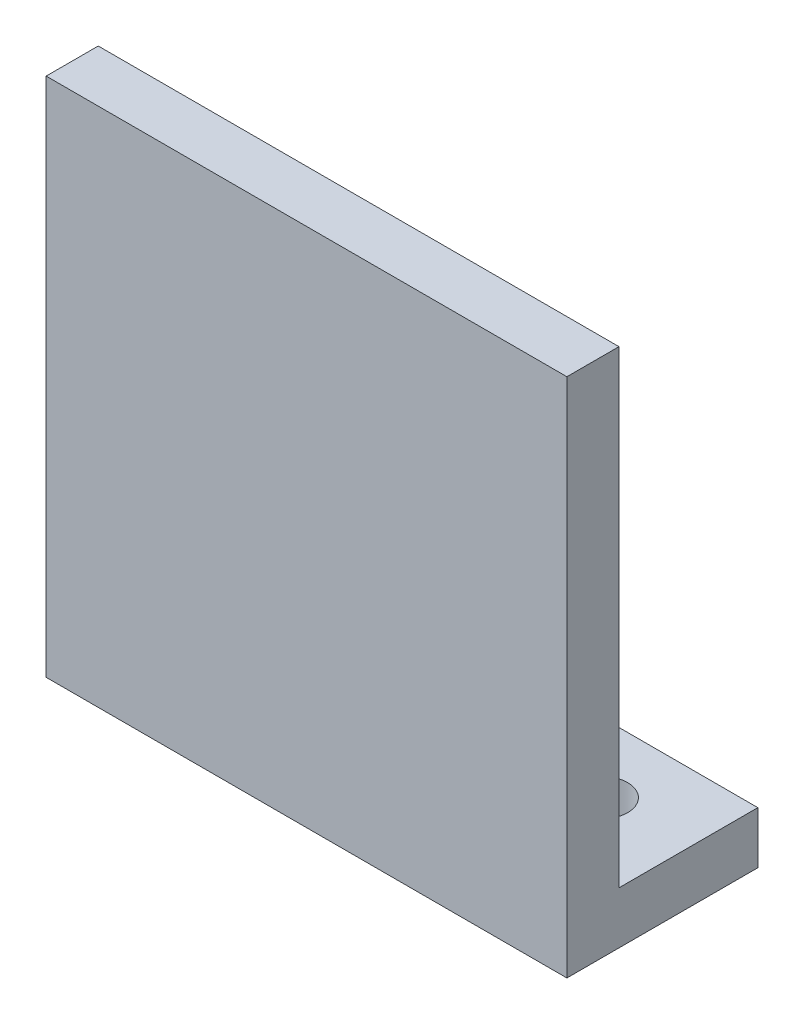
from build123d import *

# Parameters (mm, degrees)
SKETCH_1_W            = 30
SKETCH_1_H            = 30
EXTRUDE_1_DEPTH       = 3
SKETCH_2_W            = 30
SKETCH_2_H            = 3
EXTRUDE_2_DEPTH       = 8
EXTRUDE_3_OUTLINE_W   = 9.855829453
EXTRUDE_3_OUTLINE_H   = 1.616898148
EXTRUDE_3_OUTLINE_W_2 = 2.508871201
EXTRUDE_3_OUTLINE_H_2 = 1.021198831
EXTRUDE_3_DEPTH       = 2
SKETCH_4_R            = 1.5
CUT_EXTRUDE_1_DEPTH   = 32.906112399


# Read off the part's stored shape, not the designer's step: 凸台-拉伸3
with BuildPart() as part:
    # 草图1 → 凸台-拉伸1 (new body)
    with BuildSketch(Plane.XY):
        Rectangle(SKETCH_1_W, SKETCH_1_H)
    extrude(amount=EXTRUDE_1_DEPTH)

    # 草图2 → 凸台-拉伸2 (add)
    with BuildSketch(Plane(origin=(0, 0, 0), x_dir=(-1, 0, 0), z_dir=(0, 0, -1))):
        with Locations((0, -13.5)):
            Rectangle(SKETCH_2_W, SKETCH_2_H)
    extrude(amount=EXTRUDE_2_DEPTH)

    # 凸台-拉伸3 outline → 凸台-拉伸3 (add)
    # profile 1 of 7: a face of its own
    with BuildSketch(Plane(origin=(0, 0, 0), x_dir=(-1, 0, 0), z_dir=(0, 0, -1))):
        with BuildLine():
            add(Edge.make_bspline(
                [(-7.883877872, -0.091981962), (-8.014273136, -0.095319591), (-8.286344386, -0.102283592), (-8.711792724, -0.152580431), (-9.170964428, -0.235771427), (-9.487413499, -0.309118528), (-9.652064735, -0.34728167)],
                knots=[0, 0, 0, 0, 0.218453159, 0.455805081, 0.716850593, 1, 1, 1, 1], degree=3))
            Line((-7.883877872, -0.091981962), (9.687676078, -0.091981962))
            Line((9.687676078, -0.091981962), (8.200003707, 1.354716381))
            Line((8.200003707, 1.354716381), (7.178804877, 0.418617453))
            Line((7.178804877, 0.418617453), (0.484279211, 0.418617453))
            add(Edge.make_bspline(
                [(0.856197303, 1.014316771), (0.852191328, 0.958898776), (0.844084462, 0.84674976), (0.767461294, 0.687273844), (0.648127721, 0.53897471), (0.541108483, 0.460362204), (0.484279211, 0.418617453)],
                knots=[0, 0, 0, 0, 0.226102906, 0.457562904, 0.711955478, 1, 1, 1, 1], degree=3))
            add(Edge.make_bspline(
                [(-0.817434113, 2.375915211), (-0.721630556, 2.327972841), (-0.539663046, 2.236911987), (-0.282899364, 2.100929668), (-0.056069037, 1.973018309), (0.139174602, 1.850403681), (0.303845782, 1.7362347), (0.440893543, 1.633866613), (0.546212555, 1.537112963), (0.639510318, 1.422807589), (0.715903062, 1.296068897), (0.793486514, 1.177404686), (0.839652321, 1.086342529), (0.851564512, 1.034484838), (0.856197303, 1.014316771)],
                knots=[0, 0, 0, 0, 0.144926459, 0.275270644, 0.393035019, 0.497141681, 0.587034222, 0.664074804, 0.72842807, 0.779930298, 0.863111262, 0.928198056, 0.972075377, 1, 1, 1, 1], degree=3))
            Line((-0.817434113, 2.375915211), (-1.003393159, 2.120615504))
            add(Edge.make_bspline(
                [(-0.354112421, 0.418617453), (-0.362500426, 0.561245045), (-0.379562278, 0.851360607), (-0.506832291, 1.283829906), (-0.714713, 1.713501451), (-0.904647522, 1.981358491), (-1.003393159, 2.120615504)],
                knots=[0, 0, 0, 0, 0.230672027, 0.469204759, 0.724043244, 1, 1, 1, 1], degree=3))
            Line((-0.354112421, 0.418617453), (-10.487304519, 0.418617453))
            Line((-10.487304519, 0.418617453), (-9.652064735, -0.34728167))
        make_face()
    # profile 2 of 7: a face of its own
    with BuildSketch(Plane(origin=(0, 0, 0), x_dir=(-1, 0, 0), z_dir=(0, 0, -1))):
        with BuildLine():
            add(Edge.make_bspline(
                [(5.50517346, -5.368175919), (5.504512968, -5.523672258), (5.503254395, -5.819971501), (5.511695643, -6.241235963), (5.51653788, -6.617408103), (5.526053772, -6.948377629), (5.537960262, -7.234236324), (5.553693194, -7.474869964), (5.570786348, -7.670663904), (5.588723897, -7.785706695), (5.596577059, -7.836073093)],
                knots=[0, 0, 0, 0, 0.188745628, 0.359655974, 0.511439094, 0.64540111, 0.761566226, 0.858699185, 0.938137688, 1, 1, 1, 1], degree=3))
            Line((5.50517346, -5.368175919), (6.154454198, -4.942676407))
            Line((6.154454198, -4.942676407), (4.947296322, -3.836377674))
            Line((4.947296322, -3.836377674), (4.108904689, -4.602276797))
            Line((4.108904689, -4.602276797), (-5.560965717, -4.602276797))
            Line((-5.560965717, -4.602276797), (-6.862679041, -4.006577479))
            add(Edge.make_bspline(
                [(-6.862679041, -8.431772411), (-6.834696822, -8.081053429), (-6.777121088, -7.359420064), (-6.763264157, -6.254873958), (-6.778225727, -5.129478561), (-6.834720275, -4.378320486), (-6.862679041, -4.006577479)],
                knots=[0, 0, 0, 0, 0.238171099, 0.490056772, 0.747632576, 1, 1, 1, 1], degree=3))
            Line((-6.862679041, -8.431772411), (-5.560965717, -8.006272898))
            Line((-5.560965717, -8.006272898), (-5.560965717, -7.240373775))
            Line((-5.560965717, -7.240373775), (4.294863736, -7.240373775))
            Line((4.294863736, -7.240373775), (4.294863736, -8.176472703))
            Line((4.294863736, -8.176472703), (5.596577059, -7.836073093))
        make_face()
        with Locations((-0.633050991, -5.921325286)):
            Rectangle(EXTRUDE_3_OUTLINE_W, EXTRUDE_3_OUTLINE_H, mode=Mode.SUBTRACT)
    # profile 3 of 7: a face of its own
    with BuildSketch(Plane(origin=(0, 0, 0), x_dir=(-1, 0, 0), z_dir=(0, 0, -1))):
        with BuildLine():
            add(Edge.make_bspline(
                [(-4.631170486, -1.623780208), (-4.760506504, -1.627206631), (-5.0325524, -1.634413783), (-5.457075808, -1.683759923), (-5.916075791, -1.768026461), (-6.231541559, -1.840993333), (-6.396205501, -1.879079916)],
                knots=[0, 0, 0, 0, 0.217072505, 0.456591169, 0.716356417, 1, 1, 1, 1], degree=3))
            Line((-4.631170486, -1.623780208), (6.063050599, -1.623780208))
            Line((6.063050599, -1.623780208), (4.852740874, -0.432381572))
            Line((4.852740874, -0.432381572), (4.108904689, -1.113180793))
            Line((4.108904689, -1.113180793), (-7.234597134, -1.113180793))
            Line((-7.234597134, -1.113180793), (-6.396205501, -1.879079916))
        make_face()
    # profile 4 of 7: a face of its own
    with BuildSketch(Plane(origin=(0, 0, 0), x_dir=(-1, 0, 0), z_dir=(0, 0, -1))):
        with BuildLine():
            add(Edge.make_bspline(
                [(-4.164696946, -3.240678356), (-4.29509221, -3.244015985), (-4.56716346, -3.250979986), (-4.992611798, -3.301276824), (-5.451783502, -3.38446782), (-5.768232573, -3.457814921), (-5.93288381, -3.495978064)],
                knots=[0, 0, 0, 0, 0.218453159, 0.455805081, 0.716850593, 1, 1, 1, 1], degree=3))
            Line((-4.164696946, -3.240678356), (6.340413245, -3.240678356))
            Line((6.340413245, -3.240678356), (5.133255368, -2.049279721))
            Line((5.133255368, -2.049279721), (4.389419183, -2.730078941))
            Line((4.389419183, -2.730078941), (-6.768123594, -2.730078941))
            Line((-6.768123594, -2.730078941), (-5.93288381, -3.495978064))
        make_face()
    # profile 5 of 7: a face of its own
    with BuildSketch(Plane(origin=(0, 0, 0), x_dir=(-1, 0, 0), z_dir=(0, 0, -1))):
        with BuildLine():
            add(Edge.make_bspline(
                [(-3.234901715, 5.099112092), (-3.235551773, 4.997194692), (-3.236798427, 4.801741842), (-3.228323569, 4.522327705), (-3.223548545, 4.270102792), (-3.213805252, 4.04419127), (-3.201859345, 3.844470475), (-3.186315243, 3.671030427), (-3.168421576, 3.524663933), (-3.151285285, 3.436966155), (-3.143498116, 3.397114042)],
                knots=[0, 0, 0, 0, 0.179134848, 0.343537183, 0.491323426, 0.622559743, 0.740982427, 0.842972586, 0.928642726, 1, 1, 1, 1], degree=3))
            Line((-3.234901715, 5.099112092), (-2.677024576, 5.439511702))
            Line((-2.677024576, 5.439511702), (-3.701375254, 6.37561063))
            Line((-3.701375254, 6.37561063), (-4.44521144, 5.69481141))
            Line((-4.44521144, 5.69481141), (-6.676719995, 5.69481141))
            Line((-6.676719995, 5.69481141), (-7.792474273, 6.290510728))
            add(Edge.make_bspline(
                [(-7.326000733, 6.71601024), (-7.414526691, 6.655673023), (-7.590203272, 6.535935986), (-7.725403424, 6.371891056), (-7.792474273, 6.290510728)],
                knots=[0, 0, 0, 0, 0.5039144, 1, 1, 1, 1], degree=3))
            Line((-7.326000733, 6.71601024), (-1.283907653, 6.71601024))
            add(Edge.make_bspline(
                [(-4.631170486, 2.716314821), (-4.491524671, 2.695708874), (-4.226178282, 2.656554719), (-3.84966376, 2.611058386), (-3.516943295, 2.570933973), (-3.227749243, 2.546344103), (-2.981908453, 2.530311475), (-2.778897921, 2.52164569), (-2.619937333, 2.527557491), (-2.462958634, 2.544565128), (-2.295038594, 2.621573083), (-2.122684837, 2.785029584), (-1.9722409, 3.023854964), (-1.851753499, 3.272095615), (-1.762956897, 3.533043934), (-1.697837515, 3.80062016), (-1.622971544, 4.129761015), (-1.556936453, 4.523755329), (-1.487090168, 4.981797251), (-1.419142177, 5.50317383), (-1.349254729, 6.088343634), (-1.306446784, 6.499519152), (-1.283907653, 6.71601024)],
                knots=[0, 0, 0, 0, 0.063705758, 0.121049763, 0.171162397, 0.214951261, 0.252012945, 0.282375059, 0.306576652, 0.323810867, 0.353324311, 0.387900204, 0.429590006, 0.480066987, 0.512157216, 0.55379035, 0.604296276, 0.664479351, 0.734021834, 0.813423404, 0.901764165, 1, 1, 1, 1], degree=3))
            Line((-4.631170486, 2.716314821), (-4.631170486, 2.461015114))
            add(Edge.make_bspline(
                [(-2.957539069, 1.014316771), (-2.976744783, 1.090972797), (-3.015419023, 1.245333821), (-3.12745842, 1.462075019), (-3.276639421, 1.666016498), (-3.471187333, 1.852510209), (-3.701545914, 2.029815561), (-3.97472243, 2.18899115), (-4.287617097, 2.334932744), (-4.512800833, 2.417574045), (-4.631170486, 2.461015114)],
                knots=[0, 0, 0, 0, 0.102068697, 0.205534117, 0.313596329, 0.428115607, 0.553327272, 0.689398452, 0.836729783, 1, 1, 1, 1], degree=3))
            add(Edge.make_bspline(
                [(-0.168153375, 6.37561063), (-0.184404089, 6.202206897), (-0.216048847, 5.864540557), (-0.271769943, 5.370344689), (-0.340346782, 4.902341936), (-0.405508583, 4.456559781), (-0.490580467, 4.039415987), (-0.573266115, 3.645319785), (-0.669597488, 3.278103462), (-0.766214458, 2.930778383), (-0.891580631, 2.606382732), (-1.059862045, 2.307823296), (-1.272240626, 2.033280002), (-1.52509894, 1.779453984), (-1.82470385, 1.554179778), (-2.161888971, 1.347412227), (-2.542156254, 1.163934441), (-2.815750253, 1.065388003), (-2.957539069, 1.014316771)],
                knots=[0, 0, 0, 0, 0.080072776, 0.155924448, 0.228606305, 0.297536709, 0.362994913, 0.424293292, 0.482635301, 0.537506901, 0.58997895, 0.642103026, 0.694466025, 0.749113941, 0.806306908, 0.866367196, 0.930745422, 1, 1, 1, 1], degree=3))
            Line((-0.168153375, 6.37561063), (0.484279211, 6.886210045))
            Line((0.484279211, 6.886210045), (-0.631475067, 7.907408876))
            Line((-0.631475067, 7.907408876), (-1.375311252, 7.226609656))
            Line((-1.375311252, 7.226609656), (-7.048638087, 7.226609656))
            add(Edge.make_bspline(
                [(-6.304801902, 7.652109168), (-6.390276459, 7.611855136), (-6.546779647, 7.538150343), (-6.756168768, 7.427178752), (-6.922606638, 7.330208936), (-7.01043283, 7.25801481), (-7.048638087, 7.226609656)],
                knots=[0, 0, 0, 0, 0.329697503, 0.60367333, 0.827594001, 1, 1, 1, 1], degree=3))
            Line((-6.304801902, 7.652109168), (-7.883877872, 8.503108194))
            add(Edge.make_bspline(
                [(-10.581859967, 4.333212969), (-10.403172371, 4.515042619), (-10.056306953, 4.868007339), (-9.586756661, 5.415847011), (-9.170874205, 5.953370374), (-8.817572434, 6.488631946), (-8.514916636, 7.013068413), (-8.255595053, 7.521172141), (-8.044331014, 8.015092916), (-7.936302585, 8.343659393), (-7.883877872, 8.503108194)],
                knots=[0, 0, 0, 0, 0.152428867, 0.295892407, 0.431244828, 0.558637663, 0.679129134, 0.793218188, 0.899651625, 1, 1, 1, 1], degree=3))
            Line((-10.581859967, 4.333212969), (-10.487304519, 4.077913262))
            add(Edge.make_bspline(
                [(-7.883877872, 6.120310923), (-8.061696023, 5.925092794), (-8.422781929, 5.528673674), (-9.046911705, 5.000406817), (-9.733268141, 4.505316999), (-10.232242553, 4.222487769), (-10.487304519, 4.077913262)],
                knots=[0, 0, 0, 0, 0.23791436, 0.483120096, 0.73578524, 1, 1, 1, 1], degree=3))
            add(Edge.make_bspline(
                [(-7.883877872, 2.716314821), (-7.869248043, 2.847550469), (-7.839216317, 3.116947545), (-7.811970814, 3.532319287), (-7.797309829, 3.968527973), (-7.78997881, 4.418313864), (-7.79739957, 4.869143812), (-7.811744328, 5.30537005), (-7.839394936, 5.720716148), (-7.869268563, 5.989074004), (-7.883877872, 6.120310923)],
                knots=[0, 0, 0, 0, 0.116131467, 0.238391611, 0.365996644, 0.499999222, 0.634001801, 0.7625303, 0.883868533, 1, 1, 1, 1], degree=3))
            Line((-7.883877872, 2.716314821), (-6.768123594, 3.056714431))
            Line((-6.768123594, 3.056714431), (-6.768123594, 3.652413749))
            Line((-6.768123594, 3.652413749), (-4.259252393, 3.652413749))
            Line((-4.259252393, 3.652413749), (-4.259252393, 3.056714431))
            Line((-4.259252393, 3.056714431), (-3.143498116, 3.397114042))
        make_face()
        with Locations((-5.513687994, 4.67361258)):
            Rectangle(EXTRUDE_3_OUTLINE_W_2, EXTRUDE_3_OUTLINE_H_2, mode=Mode.SUBTRACT)
    # profile 6 of 7: a face of its own
    with BuildSketch(Plane(origin=(0, 0, 0), x_dir=(-1, 0, 0), z_dir=(0, 0, -1))):
        with BuildLine():
            add(Edge.make_bspline(
                [(4.947296322, 3.737513652), (4.797600927, 3.618730319), (4.496049828, 3.379449447), (4.010841647, 3.057549626), (3.503964927, 2.753446357), (2.968553622, 2.476174859), (2.408162519, 2.220805626), (1.820875599, 1.991069573), (1.208424423, 1.785567203), (0.788473955, 1.669053967), (0.57568281, 1.610016088)],
                knots=[0, 0, 0, 0, 0.116970004, 0.235628045, 0.356221885, 0.478803688, 0.60461802, 0.733165998, 0.864793786, 1, 1, 1, 1], degree=3))
            add(Edge.make_bspline(
                [(9.224354386, 1.524916186), (9.005180043, 1.590123558), (8.574161797, 1.718357396), (7.951043905, 1.94171203), (7.363733956, 2.188534566), (6.810240998, 2.452414185), (6.292101957, 2.739393343), (5.808815413, 3.04870566), (5.359367139, 3.378510259), (5.083358739, 3.618973664), (4.947296322, 3.737513652)],
                knots=[0, 0, 0, 0, 0.14119161, 0.277660967, 0.40851693, 0.534457094, 0.656140805, 0.774022274, 0.888600943, 1, 1, 1, 1], degree=3))
            add(Edge.make_bspline(
                [(10.712026756, 2.546115016), (10.608591326, 2.523803246), (10.412221397, 2.481444833), (10.138077645, 2.392008428), (9.899080237, 2.289509445), (9.691030051, 2.172629601), (9.520775061, 2.034625859), (9.385511439, 1.87960632), (9.279309618, 1.711809137), (9.242617252, 1.58702494), (9.224354386, 1.524916186)],
                knots=[0, 0, 0, 0, 0.166498476, 0.316093756, 0.453138225, 0.575412845, 0.690625886, 0.796120846, 0.898523367, 1, 1, 1, 1], degree=3))
            Line((10.712026756, 2.546115016), (10.712026756, 2.801414724))
            add(Edge.make_bspline(
                [(5.596577059, 4.418312872), (5.74335711, 4.306496491), (6.04342441, 4.077906575), (6.552093543, 3.795399146), (7.107824107, 3.536982377), (7.72363335, 3.322796903), (8.39199505, 3.137068476), (9.116239236, 2.986093245), (9.895521329, 2.874246108), (10.434392502, 2.826179393), (10.712026756, 2.801414724)],
                knots=[0, 0, 0, 0, 0.101565059, 0.207632801, 0.319806021, 0.439019942, 0.566427215, 0.70189363, 0.846411268, 1, 1, 1, 1], degree=3))
            add(Edge.make_bspline(
                [(7.642126569, 8.162708583), (7.592680973, 7.993944734), (7.493779189, 7.656380877), (7.308578417, 7.161431153), (7.099319837, 6.674743581), (6.853454906, 6.202632221), (6.587417709, 5.737133694), (6.285691719, 5.285652813), (5.95505265, 4.844756573), (5.716652526, 4.561155028), (5.596577059, 4.418312872)],
                knots=[0, 0, 0, 0, 0.122559802, 0.245145863, 0.368151307, 0.49164423, 0.616013684, 0.741755816, 0.869929636, 1, 1, 1, 1], degree=3))
            Line((7.642126569, 8.162708583), (10.431512263, 8.162708583))
            Line((10.431512263, 8.162708583), (9.03839534, 9.524307024))
            Line((9.03839534, 9.524307024), (8.108600108, 8.673307999))
            Line((8.108600108, 8.673307999), (3.273664905, 8.673307999))
            add(Edge.make_bspline(
                [(4.108904689, 10.205106244), (4.044641437, 10.088583743), (3.912268191, 9.848563808), (3.711151045, 9.475744795), (3.49658627, 9.081893738), (3.349324024, 8.811981279), (3.273664905, 8.673307999)],
                knots=[0, 0, 0, 0, 0.22880691, 0.471309999, 0.728374241, 1, 1, 1, 1], degree=3))
            Line((4.108904689, 10.205106244), (4.852740874, 10.630605757))
            Line((4.852740874, 10.630605757), (3.087705859, 11.481604782))
            add(Edge.make_bspline(
                [(0.389723764, 5.439511702), (0.569582551, 5.707411036), (0.924474343, 6.23602171), (1.39235216, 7.05594414), (1.808025201, 7.877350097), (2.155028933, 8.698066679), (2.448850768, 9.485228966), (2.712207035, 10.210058742), (2.920256658, 10.867923181), (3.03429026, 11.285842903), (3.087705859, 11.481604782)],
                knots=[0, 0, 0, 0, 0.145523541, 0.287142549, 0.425552807, 0.560599984, 0.688853501, 0.804584618, 0.908463562, 1, 1, 1, 1], degree=3))
            Line((0.389723764, 5.439511702), (0.57568281, 5.184211995))
            add(Edge.make_bspline(
                [(2.807191365, 7.737209071), (2.636215892, 7.489854533), (2.30170932, 7.005915421), (1.751118683, 6.336514392), (1.185111744, 5.723635003), (0.776258523, 5.361747305), (0.57568281, 5.184211995)],
                knots=[0, 0, 0, 0, 0.265110451, 0.518677834, 0.763872383, 1, 1, 1, 1], degree=3))
            add(Edge.make_bspline(
                [(4.294863736, 4.418312872), (4.203741147, 4.533598309), (4.021328292, 4.764381321), (3.779622354, 5.135993657), (3.559446997, 5.523691423), (3.358248119, 5.928576488), (3.187202617, 6.354405281), (3.034732561, 6.798050883), (2.904723133, 7.259779251), (2.83990741, 7.577060067), (2.807191365, 7.737209071)],
                knots=[0, 0, 0, 0, 0.119904692, 0.240030023, 0.361407154, 0.483762077, 0.608784151, 0.735715515, 0.866601147, 1, 1, 1, 1], degree=3))
            add(Edge.make_bspline(
                [(0.484279211, 1.865315796), (0.667720071, 1.95228007), (1.030378937, 2.12420668), (1.558982972, 2.402508772), (2.065844898, 2.698077863), (2.551093105, 3.011692658), (3.020148422, 3.335610542), (3.466448914, 3.679368115), (3.893707884, 4.037698718), (4.161633854, 4.291905196), (4.294863736, 4.418312872)],
                knots=[0, 0, 0, 0, 0.132132501, 0.26122328, 0.388717404, 0.513916616, 0.637226403, 0.759645498, 0.880480411, 1, 1, 1, 1], degree=3))
            Line((0.484279211, 1.865315796), (0.57568281, 1.610016088))
        make_face()
        with BuildLine():
            add(Edge.make_bspline(
                [(3.179109458, 8.162708583), (3.226886255, 8.016102536), (3.321583375, 7.725518587), (3.490400156, 7.303608357), (3.67289991, 6.896420425), (3.871291604, 6.504308654), (4.088887079, 6.128457338), (4.32624598, 5.769816003), (4.577293066, 5.423760005), (4.760982824, 5.207259838), (4.852740874, 5.099112092)],
                knots=[0, 0, 0, 0, 0.131534571, 0.260711175, 0.38750181, 0.51218338, 0.635494266, 0.757820441, 0.879024697, 1, 1, 1, 1], degree=3))
            Line((3.179109458, 8.162708583), (6.340413245, 8.162708583))
            add(Edge.make_bspline(
                [(4.852740874, 5.099112092), (4.943297471, 5.231727353), (5.121355971, 5.492484439), (5.362351711, 5.890706859), (5.584680144, 6.281949048), (5.782376863, 6.667872531), (5.957498473, 7.04836485), (6.107820311, 7.423158354), (6.240303166, 7.792184734), (6.307351455, 8.040341467), (6.340413245, 8.162708583)],
                knots=[0, 0, 0, 0, 0.140721885, 0.276696881, 0.407817849, 0.535072877, 0.656626358, 0.774784017, 0.888945063, 1, 1, 1, 1], degree=3))
        make_face(mode=Mode.SUBTRACT)
    # profile 7 of 7: a face of its own
    with BuildSketch(Plane(origin=(0, 0, 0), x_dir=(-1, 0, 0), z_dir=(0, 0, -1))):
        with BuildLine():
            add(Edge.make_bspline(
                [(-3.143498116, 9.439207122), (-3.14512329, 9.577897892), (-3.148620675, 9.876361229), (-3.164862216, 10.355558469), (-3.193515559, 10.897746988), (-3.220606026, 11.279927461), (-3.234901715, 11.481604782)],
                knots=[0, 0, 0, 0, 0.203484576, 0.437899982, 0.703378813, 1, 1, 1, 1], degree=3))
            Line((-3.143498116, 9.439207122), (-5.560965717, 9.439207122))
            Line((-5.560965717, 9.439207122), (-5.560965717, 10.290206147))
            Line((-5.560965717, 10.290206147), (-5.003088578, 10.800805562))
            Line((-5.003088578, 10.800805562), (-6.768123594, 11.481604782))
            add(Edge.make_bspline(
                [(-6.676719995, 9.439207122), (-6.678007833, 9.652498289), (-6.680406277, 10.049727259), (-6.695556882, 10.603553856), (-6.720099937, 11.071781315), (-6.753239877, 11.354590374), (-6.768123594, 11.481604782)],
                knots=[0, 0, 0, 0, 0.312780387, 0.582515595, 0.81250058, 1, 1, 1, 1], degree=3))
            Line((-6.676719995, 9.439207122), (-10.767819013, 9.439207122))
            Line((-10.767819013, 9.439207122), (-9.929427381, 8.673307999))
            add(Edge.make_bspline(
                [(-8.350351411, 8.928607706), (-8.453434715, 8.924963364), (-8.679391074, 8.916975046), (-9.045843887, 8.866012719), (-9.468755991, 8.781634908), (-9.768897115, 8.711056702), (-9.929427381, 8.673307999)],
                knots=[0, 0, 0, 0, 0.192957455, 0.422958543, 0.691369788, 1, 1, 1, 1], degree=3))
            Line((-8.350351411, 8.928607706), (-6.676719995, 8.928607706))
            Line((-6.676719995, 8.928607706), (-6.676719995, 7.992508778))
            Line((-6.676719995, 7.992508778), (-5.560965717, 8.247808486))
            Line((-5.560965717, 8.247808486), (-5.560965717, 8.928607706))
            Line((-5.560965717, 8.928607706), (-3.143498116, 8.928607706))
            Line((-3.143498116, 8.928607706), (-3.143498116, 7.907408876))
            Line((-3.143498116, 7.907408876), (-1.933188391, 8.247808486))
            add(Edge.make_bspline(
                [(-2.027743838, 8.928607706), (-2.026428053, 8.882318089), (-2.023607883, 8.7831039), (-2.001479451, 8.623602136), (-1.97511444, 8.442307865), (-1.947651923, 8.314906341), (-1.933188391, 8.247808486)],
                knots=[0, 0, 0, 0, 0.201668386, 0.432243049, 0.70098259, 1, 1, 1, 1], degree=3))
            Line((-2.027743838, 8.928607706), (1.414074442, 8.928607706))
            Line((1.414074442, 8.928607706), (0.112361118, 10.205106244))
            Line((0.112361118, 10.205106244), (-0.726030514, 9.439207122))
            Line((-0.726030514, 9.439207122), (-2.027743838, 9.439207122))
            Line((-2.027743838, 9.439207122), (-2.027743838, 10.375306049))
            Line((-2.027743838, 10.375306049), (-1.561270298, 10.800805562))
            Line((-1.561270298, 10.800805562), (-3.234901715, 11.481604782))
        make_face()
    extrude(amount=EXTRUDE_3_DEPTH)

    # 草图4 → 切除-拉伸1 (cut, through all)
    with BuildSketch(Plane(origin=(0, -12, 0), x_dir=(1, 0, 0), z_dir=(0, 1, 0))):
        with Locations(Location((-10, 3.999978925, 0), (0, 0, 180))):
            Circle(SKETCH_4_R)
        with Locations((10, 3.999978925)):
            Circle(SKETCH_4_R)
    extrude(amount=-CUT_EXTRUDE_1_DEPTH, mode=Mode.SUBTRACT)


solid = part.part
